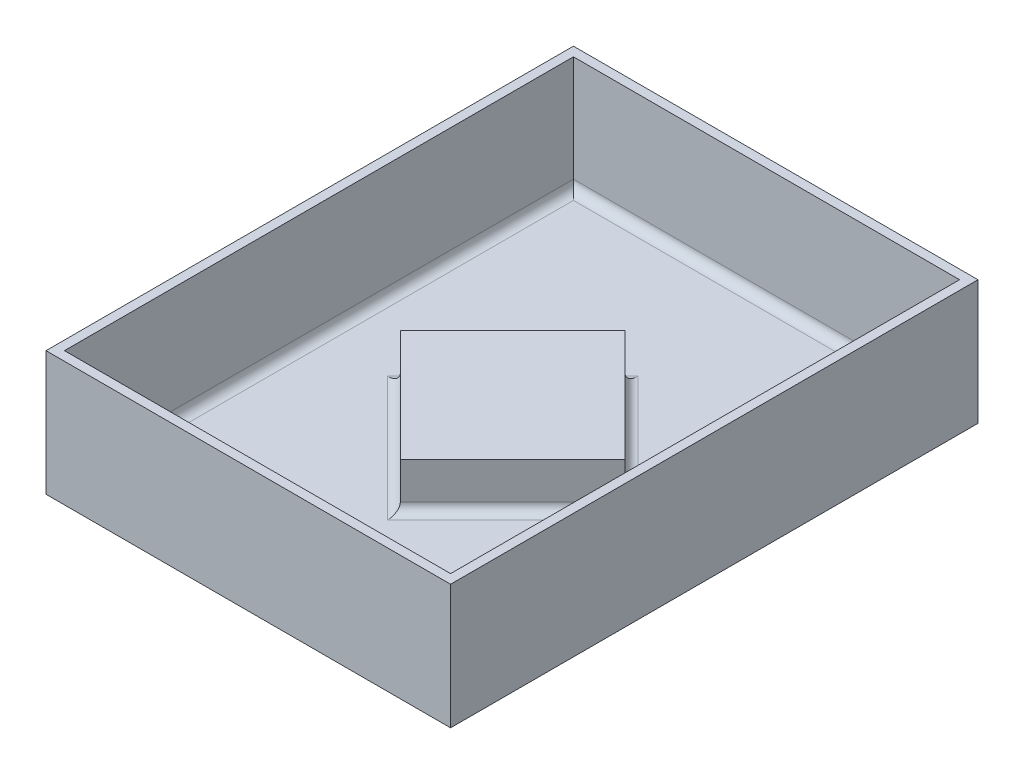
from build123d import *

# Parameters (mm, degrees)
SKETCH2_W           = 439.1
SKETCH2_H           = 572.45
SKETCH2_W_2         = 419.1
SKETCH2_H_2         = 552.45
BOSS_EXTRUDE1_DEPTH = 125
BOSS_EXTRUDE2_DEPTH = 50
SKETCH4_W           = 439.1
SKETCH4_H           = 572.45
BOSS_EXTRUDE3_DEPTH = 10
FILLET1_R           = 10


with BuildPart() as part:
    # Sketch2 → Boss-Extrude1 (new body)
    with BuildSketch(Plane(origin=(0, 0, 0), x_dir=(1, 0, 0), z_dir=(0, 1, 0))):
        with Locations((209.55, 276.225)):
            Rectangle(SKETCH2_W, SKETCH2_H)
        with Locations((209.55, 276.225)):
            Rectangle(SKETCH2_W_2, SKETCH2_H_2, mode=Mode.SUBTRACT)
    extrude(amount=BOSS_EXTRUDE1_DEPTH)



with BuildPart() as body_2:
    # Sketch3 → Boss-Extrude2 (new body)
    with BuildSketch(Plane(origin=(0, 0, 0), x_dir=(1, 0, 0), z_dir=(0, 1, 0))):
        Polygon((88.316542366, 276.225), (209.55, 154.991542366), (331.455559866, 276.897102232), (210.222102232, 398.130559866), align=None)
    extrude(amount=BOSS_EXTRUDE2_DEPTH)


with BuildPart() as part_1:
    add(part.part)

    add(body_2.part)  # Boss-Extrude3 merges body 2
    # Sketch4 → Boss-Extrude3 (add)
    with BuildSketch(Plane(origin=(0, 0, 0), x_dir=(1, 0, 0), z_dir=(0, 1, 0))):
        with Locations((209.55, 276.225)):
            Rectangle(SKETCH4_W, SKETCH4_H)
    extrude(amount=-BOSS_EXTRUDE3_DEPTH)

    # Fillet1
    fillet1_edges = [part_1.edges().sort_by_distance(p)[0] for p in [
        (270.502779933, 0, -215.944322299),
        (270.838831049, 0, -337.513831049),
        (149.269322299, 0, -337.177779933),
        (148.933271183, 0, -215.608271183),
        (419.1, 0, -276.225),
        (209.55, 0, 0),
        (0, 0, -276.225),
        (209.55, 0, -552.45),
    ]]
    fillet(fillet1_edges, radius=FILLET1_R)


solid = part_1.part
